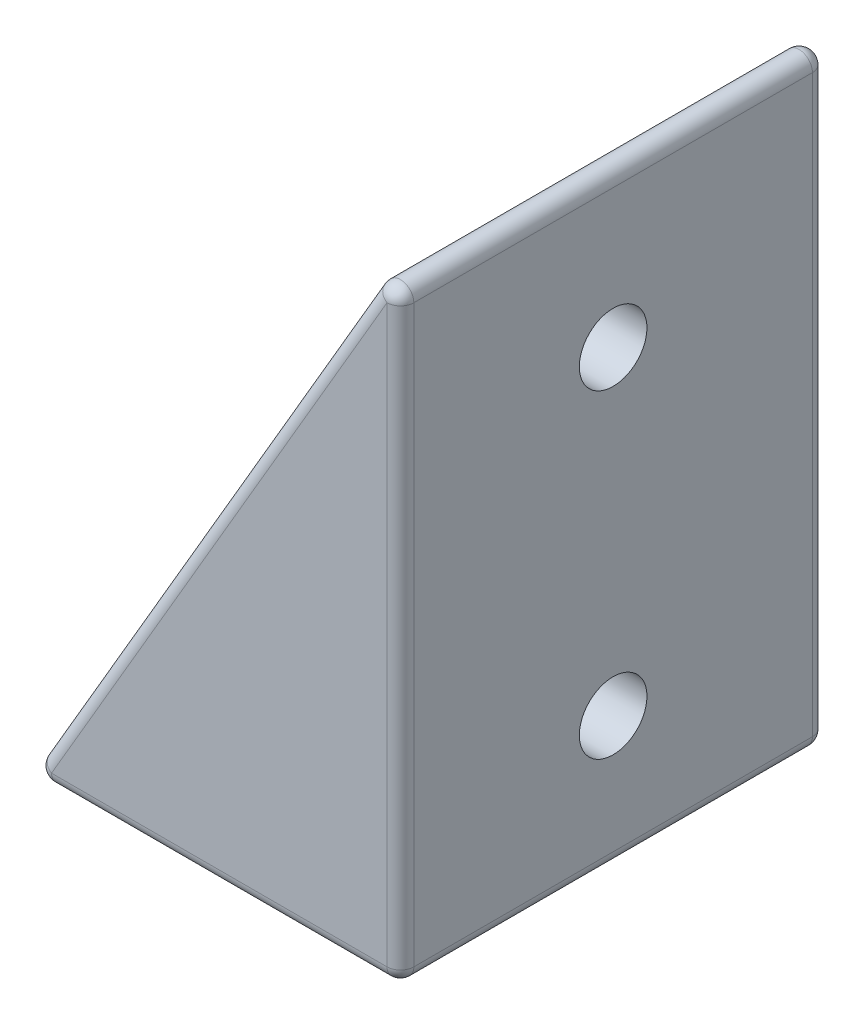
from build123d import *

# Parameters (mm, degrees)
BOSS_EXTRUDE1_DEPTH = 25.4
FILLET1_R           = 0.8
SKETCH2_R           = 2.0193
CUT_EXTRUDE1_DEPTH  = 50.8


with BuildPart() as part:
    # Sketch1 → Boss-Extrude1 (new body)
    with BuildSketch(Plane.XY):
        Polygon((0, 0), (0, 38.1), (-22.225, 0), align=None)
    extrude(amount=BOSS_EXTRUDE1_DEPTH)

    # Fillet1
    fillet1_edges = [part.edges().sort_by_distance(p)[0] for p in [
        (-11.1125, 0, 0),
        (0, 19.05, 0),
        (-11.1125, 19.05, 0),
        (-11.1125, 0, 25.4),
        (-11.1125, 19.05, 25.4),
        (-22.225, 0, 12.7),
        (0, 38.1, 12.7),
        (0, 0, 12.7),
        (0, 19.05, 25.4),
    ]]
    fillet(fillet1_edges, radius=FILLET1_R)

    # Sketch2 → Cut-Extrude1 (cut)
    with BuildSketch(Plane(origin=(0, 0, 0), x_dir=(0, 0, -1), z_dir=(1, 0, 0))):
        with Locations((-12.7, 26.885863544)):
            Circle(SKETCH2_R)
        with Locations((-12.7, 7.835863544)):
            Circle(SKETCH2_R)
    extrude(amount=-CUT_EXTRUDE1_DEPTH, mode=Mode.SUBTRACT)


solid = part.part
